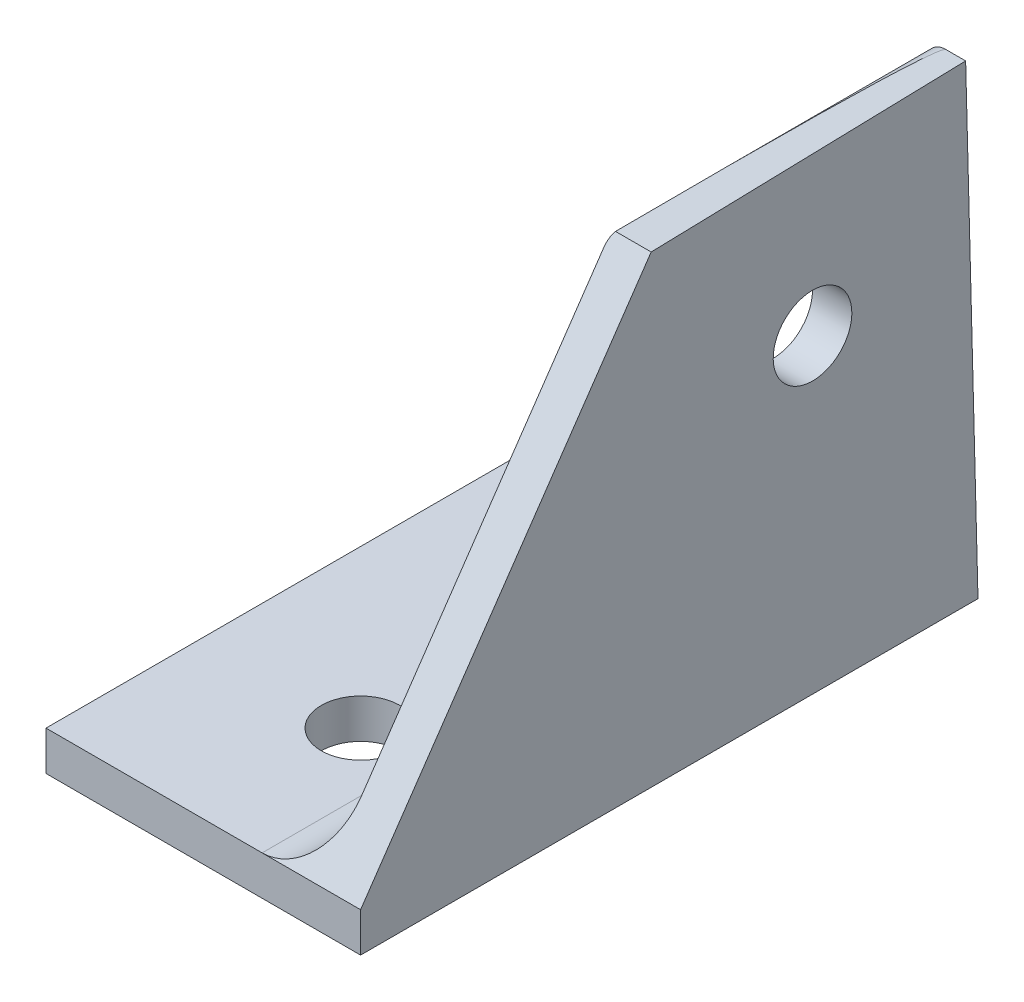
from build123d import *

# Parameters (mm, degrees)
BOSS_EXTRUDE1_DEPTH = 25.4
SKETCH3_R           = 3.175
SKETCH3_W           = 12.7
SKETCH3_H           = 50.8
CUT_EXTRUDE1_DEPTH  = 50.595085442
SKETCH12_OUTSIDE_W  = 66.478
SKETCH12_OUTSIDE_H  = 53.778
CUT_EXTRUDE2_DEPTH  = 41.659838908
SKETCH13_R          = 3.175
CUT_EXTRUDE3_DEPTH  = 41.659838908


with BuildPart() as part:
    # Sketch2 → Boss-Extrude1 (new, symmetric)
    with BuildSketch(Plane.XY):
        with BuildLine():
            Line((-19.05, -19.05), (19.05, -19.05))
            Line((19.05, -19.05), (19.05, 19.05))
            Line((19.05, 19.05), (17.4625, 19.05))
            ThreePointArc((17.4625, 19.05), (16.339967985, 18.585032015), (15.875, 17.4625))
            Line((15.875, 17.4625), (15.875, -11.0998))
            ThreePointArc((15.875, -11.0998), (14.476376302, -14.476376302), (11.0998, -15.875))
            Line((11.0998, -15.875), (-17.4625, -15.875))
            ThreePointArc((-17.4625, -15.875), (-18.585032015, -16.339967985), (-19.05, -17.4625))
            Line((-19.05, -17.4625), (-19.05, -19.05))
        make_face()
    extrude(amount=BOSS_EXTRUDE1_DEPTH, both=True)

    # Sketch3 → Cut-Extrude1 (cut, through all)
    with BuildSketch(Plane.XZ.offset(19.05)):
        with Locations((6.35, 12.7)):
            Circle(SKETCH3_R)
        with Locations((6.35, -12.7)):
            Circle(SKETCH3_R)
        with Locations((-12.7, 0)):
            Rectangle(SKETCH3_W, SKETCH3_H)
    extrude(amount=-CUT_EXTRUDE1_DEPTH, mode=Mode.SUBTRACT)

    # Sketch12 outside → Cut-Extrude2 (cut, through all)
    with BuildSketch(Plane(origin=(19.05, 0, 0), x_dir=(0, 0, -1), z_dir=(1, 0, 0))):
        Rectangle(SKETCH12_OUTSIDE_W, SKETCH12_OUTSIDE_H)
        Polygon((23.451834826, 19.05), (24.449518438, -19.05), (-25.4, -19.05), (-25.4, -15.875), (-1.939461228, 18.385105513), align=None, mode=Mode.SUBTRACT)
    extrude(amount=-CUT_EXTRUDE2_DEPTH, mode=Mode.SUBTRACT)

    # Sketch13 → Cut-Extrude3 (cut, through all)
    with BuildSketch(Plane(origin=(19.05, 0, 0), x_dir=(0, 0, -1), z_dir=(1, 0, 0))):
        with Locations((11.088634042, 6.021904729)):
            Circle(SKETCH13_R)
    extrude(amount=-CUT_EXTRUDE3_DEPTH, mode=Mode.SUBTRACT)


solid = part.part
